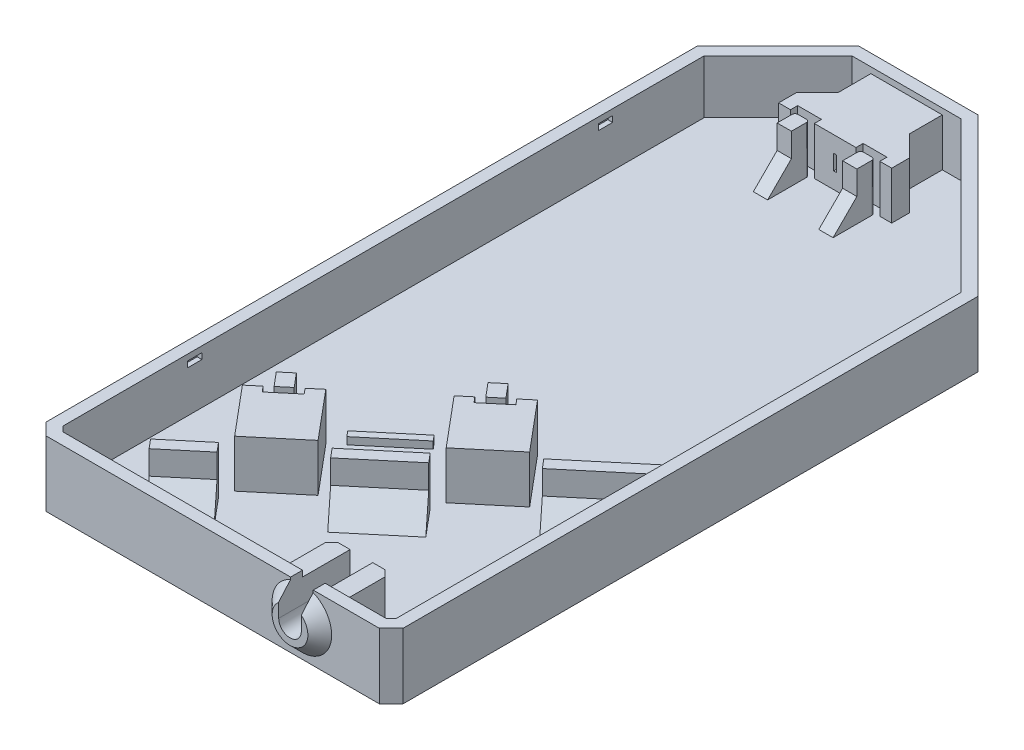
from build123d import *

# Parameters (mm, degrees)
BOSS_EXTRUDE1_DEPTH     = 11
SHELL1_T                = -2
CUT_EXTRUDE7_START      = -0.8
SKETCH18_W              = 2.4
SKETCH18_H              = 1
CUT_EXTRUDE7_DEPTH      = 57.6
SKETCH17_W              = 2.4
SKETCH17_H              = 1
CUT_EXTRUDE8_DEPTH      = 0.8
BOSS_EXTRUDE2_DEPTH     = 8
CUT_EXTRUDE1_DEPTH      = 7.5
CUT_EXTRUDE2_REACH      = 123.767
SKETCH6_R               = 1.3
BOSS_EXTRUDE6_DEPTH     = 8
SKETCH7_R               = 5
BOSS_EXTRUDE4_DEPTH     = 2
CHAMFER2_SIZE           = 2
BOSS_EXTRUDE8_DEPTH     = 8
CUT_EXTRUDE3_REACH      = 132.958
SKETCH9_R               = 1.9
SKETCH10_W              = 3.8
SKETCH10_H              = 12
CUT_EXTRUDE4_DEPTH      = 5
CUT_EXTRUDE5_DEPTH      = 6.75
CUT_EXTRUDE5_DEPTH_BACK = 0.4
SKETCH11_W              = 4.2
SKETCH11_H              = 4
SKETCH13_W              = 3.25
SKETCH13_H              = 8
BOSS_EXTRUDE5_DEPTH     = 1
CHAMFER3_SIZE           = 4
SKETCH16_R              = 0.95
BOSS_EXTRUDE7_DEPTH     = 0.5
CHAMFER4_SIZE           = 0.5
SKETCH21_W              = 0.4
SKETCH21_H              = 3.5
BOSS_EXTRUDE9_DEPTH     = 0.2
CHAMFER5_SIZE           = 0.2
BOSS_EXTRUDE10_DEPTH    = 1.2


with BuildPart() as part:
    # Sketch1 → Boss-Extrude1 (new body)
    with BuildSketch(Plane(origin=(0, 0, 0), x_dir=(1, 0, 0), z_dir=(0, 1, 0))):
        Polygon((-30, 111.4), (-30, 2), (-28, 0), (28, 0), (30, 2), (30, 98.6), (3.6, 125), (-16.4, 125), align=None)
    extrude(amount=BOSS_EXTRUDE1_DEPTH)

    # Shell1
    shell1_openings = [part.faces().sort_by_distance(p)[0] for p in [
        (-0.71333666, 11, -59.122726448),
    ]]
    offset(amount=SHELL1_T, openings=shell1_openings, kind=Kind.INTERSECTION)

    # Sketch18 → Cut-Extrude7 (cut)
    with BuildSketch(Plane(origin=(-28, 0, 0), x_dir=(0, 0, -1), z_dir=(1, 0, 0)).offset(CUT_EXTRUDE7_START)):
        with Locations((25, 9.5)):
            Rectangle(SKETCH18_W, SKETCH18_H)
        with Locations((94, 9.5)):
            Rectangle(SKETCH18_W, SKETCH18_H)
    extrude(amount=CUT_EXTRUDE7_DEPTH, mode=Mode.SUBTRACT)

    # Sketch17 → Cut-Extrude8 (cut)
    with BuildSketch(Plane.XY.offset(-2)):
        with Locations((0, 9.5)):
            Rectangle(SKETCH17_W, SKETCH17_H)
    extrude(amount=CUT_EXTRUDE8_DEPTH, mode=Mode.SUBTRACT)

    # Sketch4 → Boss-Extrude2 (add)
    with BuildSketch(Plane(origin=(0, 2, 0), x_dir=(1, 0, 0), z_dir=(0, 1, 0))):
        Polygon((-12.4, 117.5), (-15.9, 114), (-15.9, 111), (-13.9, 111), (-13.9, 112.2), (-9.9, 112.2), (-9.9, 111), (-2.9, 111), (-2.9, 112.2), (1.1, 112.2), (1.1, 111), (3.1, 111), (3.1, 114), (-0.4, 117.5), (-0.4, 123), (-12.4, 123), align=None)
        with BuildLine():
            Line((-12.6, 110.95), (-11.2, 110.95))
            ThreePointArc((-11.2, 110.95), (-10.846446609, 110.803553391), (-10.7, 110.45))
            Line((-10.7, 110.45), (-10.7, 107.95))
            Line((-10.7, 107.95), (-13.1, 107.95))
            Line((-13.1, 107.95), (-13.1, 110.45))
            ThreePointArc((-13.1, 110.45), (-12.953553391, 110.803553391), (-12.6, 110.95))
        make_face()
        with BuildLine():
            Line((-0.2, 110.95), (-1.6, 110.95))
            ThreePointArc((-1.6, 110.95), (-1.953553391, 110.803553391), (-2.1, 110.45))
            Line((-2.1, 110.45), (-2.1, 107.95))
            Line((-2.1, 107.95), (0.3, 107.95))
            Line((0.3, 107.95), (0.3, 110.45))
            ThreePointArc((0.3, 110.45), (0.153553391, 110.803553391), (-0.2, 110.95))
        make_face()
    extrude(amount=BOSS_EXTRUDE2_DEPTH)

    # Sketch5 → Cut-Extrude1 (cut)
    with BuildSketch(Plane(origin=(0, 0, -125), x_dir=(-1, 0, 0), z_dir=(0, 0, -1))):
        with BuildLine():
            Line((4.225, 9.175), (8.575, 9.175))
            Line((8.575, 9.175), (9.575, 9.175))
            Line((9.575, 9.175), (9.575, 8.175))
            Line((9.575, 8.175), (9.575, 6.8))
            ThreePointArc((9.575, 6.8), (10.375, 6), (9.575, 5.2))
            Line((9.575, 5.2), (9.575, 2.825))
            Line((9.575, 2.825), (3.225, 2.825))
            Line((3.225, 2.825), (3.225, 5.2))
            ThreePointArc((3.225, 5.2), (2.425, 6), (3.225, 6.8))
            Line((3.225, 6.8), (3.225, 8.175))
            Line((3.225, 8.175), (3.225, 9.175))
            Line((3.225, 9.175), (4.225, 9.175))
        make_face()
    extrude(amount=-CUT_EXTRUDE1_DEPTH, mode=Mode.SUBTRACT)

    # Sketch6 → Cut-Extrude2 (cut, up to next)
    with BuildSketch(Plane(origin=(0, 0, -117.5), x_dir=(-1, 0, 0), z_dir=(0, 0, -1)), mode=Mode.PRIVATE) as cut_extrude2_sk1:
        with Locations((6.4, 6)):
            Circle(SKETCH6_R)
    cut_extrude2_tool1 = extrude(cut_extrude2_sk1.sketch, amount=-CUT_EXTRUDE2_REACH, mode=Mode.PRIVATE) & part.part
    add(cut_extrude2_tool1.solids().sort_by_distance((-6.4, 6, -117.5))[0], mode=Mode.SUBTRACT)

    # Sketch15 → Boss-Extrude6 (add)
    with BuildSketch(Plane(origin=(0, 2, 0), x_dir=(1, 0, 0), z_dir=(0, 1, 0))):
        Polygon((-19.882382199, 24.879471387), (-13.100972917, 16.797702512), (-5.478830708, 23.193439228), (-12.26023999, 31.275208103), (-14.156199987, 29.684308769), (-13.384854855, 28.765055438), (-17.215077071, 25.551117389), (-17.986422202, 26.470370721), align=None)
        Polygon((-12.262235661, 12.997831486), (-13.54781088, 14.529920372), (-19.75277087, 9.323340734), (-18.46719565, 7.791251847), align=None)
        Polygon((5.794811308, 30.760307517), (-3.167908676, 23.239692483), (-1.882333457, 21.707603597), (7.080386528, 29.22821863), align=None)
        Polygon((28, 46.781858579), (28, 49.392673158), (16.174713513, 39.470079628), (17.460288732, 37.937990742), align=None)
        Polygon((-17.022703807, 27.344296836), (-15.184197143, 28.886987099), (-17.112559972, 31.185120428), (-18.951066636, 29.642430165), align=None)
        Polygon((0.391555553, 45.87281731), (2.319918382, 43.57468398), (4.158425046, 45.117374244), (2.230062217, 47.415507573), align=None)
        Polygon((7.082382199, 47.505595248), (5.186422202, 45.914695914), (5.957767334, 44.995442582), (2.127545118, 41.781504534), (1.356199987, 42.700757866), (-0.53976001, 41.109858532), (6.370206794, 32.874880768), (13.992349003, 39.270617484), align=None)
    extrude(amount=BOSS_EXTRUDE6_DEPTH)

    # Sketch7 → Boss-Extrude4 (add)
    with BuildSketch(Plane.XY):
        with Locations(Location((15, 6, 0), (0, 0, 90))):
            Circle(SKETCH7_R)
    extrude(amount=BOSS_EXTRUDE4_DEPTH)

    # Chamfer2
    chamfer2_edges = [part.edges().sort_by_distance(p)[0] for p in [
        (15, 1, 2),
    ]]
    chamfer(chamfer2_edges, length=CHAMFER2_SIZE - 0.0001)  # a hair under: the kernel refuses the full size

    # Sketch19 → Boss-Extrude8 (add)
    with BuildSketch(Plane(origin=(0, 2, 0), x_dir=(1, 0, 0), z_dir=(0, 1, 0))):
        Polygon((10, 2), (20, 2), (20, 9), (19, 10), (11, 10), (10, 9), align=None)
    extrude(amount=BOSS_EXTRUDE8_DEPTH)

    # Sketch9 → Cut-Extrude3 (cut, up to next)
    with BuildSketch(Plane.XY.offset(2), mode=Mode.PRIVATE) as cut_extrude3_sk1:
        with Locations((15, 6)):
            Circle(SKETCH9_R)
    cut_extrude3_tool1 = extrude(cut_extrude3_sk1.sketch, amount=-CUT_EXTRUDE3_REACH, mode=Mode.PRIVATE) & part.part
    add(cut_extrude3_tool1.solids().sort_by_distance((15, 6, 2))[0], mode=Mode.SUBTRACT)

    # Sketch10 → Cut-Extrude4 (cut)
    with BuildSketch(Plane(origin=(0, 11, 0), x_dir=(1, 0, 0), z_dir=(0, 1, 0))):
        with Locations((15, 4)):
            Rectangle(SKETCH10_W, SKETCH10_H)
    extrude(amount=-CUT_EXTRUDE4_DEPTH, mode=Mode.SUBTRACT)

    # Sketch11 → Cut-Extrude5 (cut, two sides: drawn at the far end of the back side and taken through both)
    with BuildSketch(Plane.XZ.offset(-9.175).offset(-CUT_EXTRUDE5_DEPTH_BACK)):
        with Locations((-6.4, -119.5)):
            Rectangle(SKETCH11_W, SKETCH11_H)
    extrude(amount=CUT_EXTRUDE5_DEPTH + CUT_EXTRUDE5_DEPTH_BACK, mode=Mode.SUBTRACT)

    # Sketch13 → Boss-Extrude5 (add)
    with BuildSketch(Plane.XY.offset(-111)):
        with Locations((-8.275, 6)):
            Rectangle(SKETCH13_W, SKETCH13_H)
        with Locations((-4.525, 6)):
            Rectangle(SKETCH13_W, SKETCH13_H)
    extrude(amount=-BOSS_EXTRUDE5_DEPTH)

    # Chamfer3
    chamfer3_edges = [part.edges().sort_by_distance(p)[0] for p in [
        (-0.9, 2, -107.95),
        (-11.9, 2, -107.95),
        (2.599026536, 2, -25.467911114),
        (-18.031813304, 2, -30.413775297),
        (-15.364715656, 2, -10.394541667),
        (1.310808885, 2, -46.644162441),
        (22.730144366, 2, -42.35992466),
    ]]
    chamfer(chamfer3_edges, length=CHAMFER3_SIZE)

    # Sketch16 → Boss-Extrude7 (add)
    with BuildSketch(Plane(origin=(-12.752218221, 0, -15.197501879), x_dir=(-0.7660444431189747, 0, 0.6427876096865435), z_dir=(-0.6427876096865434, 0, -0.7660444431189746))):
        with Locations((-48.861427544, 8)):
            Circle(SKETCH16_R)
        with Locations((-48.861427544, 4)):
            Circle(SKETCH16_R)
        with Locations((2.638572456, 8)):
            Circle(SKETCH16_R)
    extrude(amount=BOSS_EXTRUDE7_DEPTH)

    # Chamfer4
    chamfer4_edges = [part.edges().sort_by_distance(p)[0] for p in [
        (25.084155247, 8, -47.598692546),
        (25.084155247, 4, -47.598692546),
        (-14.367133573, 8, -14.495130647),
    ]]
    chamfer(chamfer4_edges, length=CHAMFER4_SIZE - 0.0001)  # a hair under: the kernel refuses the full size

    # Sketch21 → Boss-Extrude9 (add)
    with BuildSketch(Plane.XZ.offset(-2.825)):
        with Locations((-8.3, -123.25)):
            Rectangle(SKETCH21_W, SKETCH21_H)
        with Locations((-4.5, -123.25)):
            Rectangle(SKETCH21_W, SKETCH21_H)
    extrude(amount=-BOSS_EXTRUDE9_DEPTH)

    # Chamfer5
    chamfer5_edges = [part.edges().sort_by_distance(p)[0] for p in [
        (-4.5, 3.025, -125),
        (-8.3, 3.025, -125),
    ]]
    chamfer(chamfer5_edges, length=CHAMFER5_SIZE)

    # Sketch22 → Boss-Extrude10 (add)
    with BuildSketch(Plane(origin=(0, 2, 0), x_dir=(1, 0, 0), z_dir=(0, 1, 0))):
        Polygon((-10.409407643, 32.958781572), (-2.519149879, 39.579493952), (-3.290495011, 40.498747283), (-11.180752775, 33.878034904), align=None)
    extrude(amount=BOSS_EXTRUDE10_DEPTH)


solid = part.part
